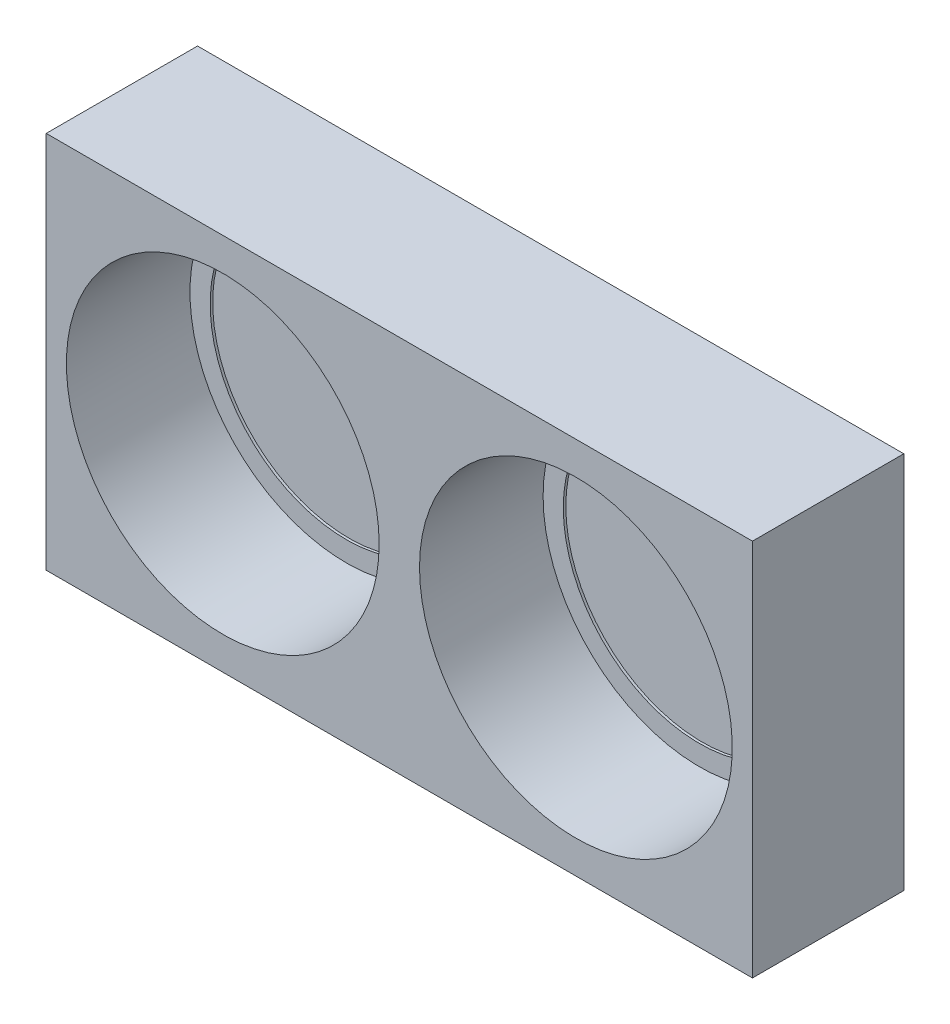
from build123d import *

# Parameters (mm, degrees)
ESQUISSE1_W                  = 140
ESQUISSE1_H                  = 75
BOSS_EXTRU_1_DEPTH           = 30
ESQUISSE2_R                  = 31
ENL_V_MAT_EXTRU_1_DEPTH      = 25
ENL_V_MAT_EXTRU_2_DEPTH      = 161.779351908
ENL_V_MAT_EXTRU_2_DEPTH_BACK = 161.779351908
ESQUISSE3_R                  = 3.4
BOSS_EXTRU_2_START           = 0.5
ESQUISSE4_R                  = 31
ESQUISSE4_R_2                = 27
BOSS_EXTRU_2_DEPTH           = 0.5


with BuildPart() as part:
    # Esquisse1 → Boss.-Extru.1 (new body)
    with BuildSketch(Plane.XY):
        with Locations((70, 37.5)):
            Rectangle(ESQUISSE1_W, ESQUISSE1_H)
    extrude(amount=BOSS_EXTRU_1_DEPTH)

    # Esquisse2 → Enlèv. mat.-Extru.1 (cut)
    with BuildSketch(Plane.XY.offset(30)):
        with Locations((35, 37.5)):
            Circle(ESQUISSE2_R)
        with Locations((105, 37.5)):
            Circle(ESQUISSE2_R)
    extrude(amount=-ENL_V_MAT_EXTRU_1_DEPTH, mode=Mode.SUBTRACT)

    # Esquisse3 → Enlèv. mat.-Extru.2 (cut, two sides: drawn at the far end of the back side and taken through both)
    with BuildSketch(Plane.XY.offset(5).offset(-ENL_V_MAT_EXTRU_2_DEPTH_BACK)):
        with Locations((35, 37.5)):
            Circle(ESQUISSE3_R)
        with Locations((105, 37.5)):
            Circle(ESQUISSE3_R)
    extrude(amount=ENL_V_MAT_EXTRU_2_DEPTH + ENL_V_MAT_EXTRU_2_DEPTH_BACK, mode=Mode.SUBTRACT)

    # Esquisse4 → Boss.-Extru.2 (add)
    # profile 1 of 2: a face of its own
    with BuildSketch(Plane.XY.offset(5).offset(BOSS_EXTRU_2_START)):
        with Locations((35, 37.5)):
            Circle(ESQUISSE4_R)
        with Locations((35, 37.5)):
            Circle(ESQUISSE4_R_2, mode=Mode.SUBTRACT)
    # profile 2 of 2: a face of its own
    with BuildSketch(Plane.XY.offset(5).offset(BOSS_EXTRU_2_START)):
        with Locations((105, 37.5)):
            Circle(ESQUISSE4_R)
        with Locations((105, 37.5)):
            Circle(ESQUISSE4_R_2, mode=Mode.SUBTRACT)
    extrude(amount=-BOSS_EXTRU_2_DEPTH)


solid = part.part
